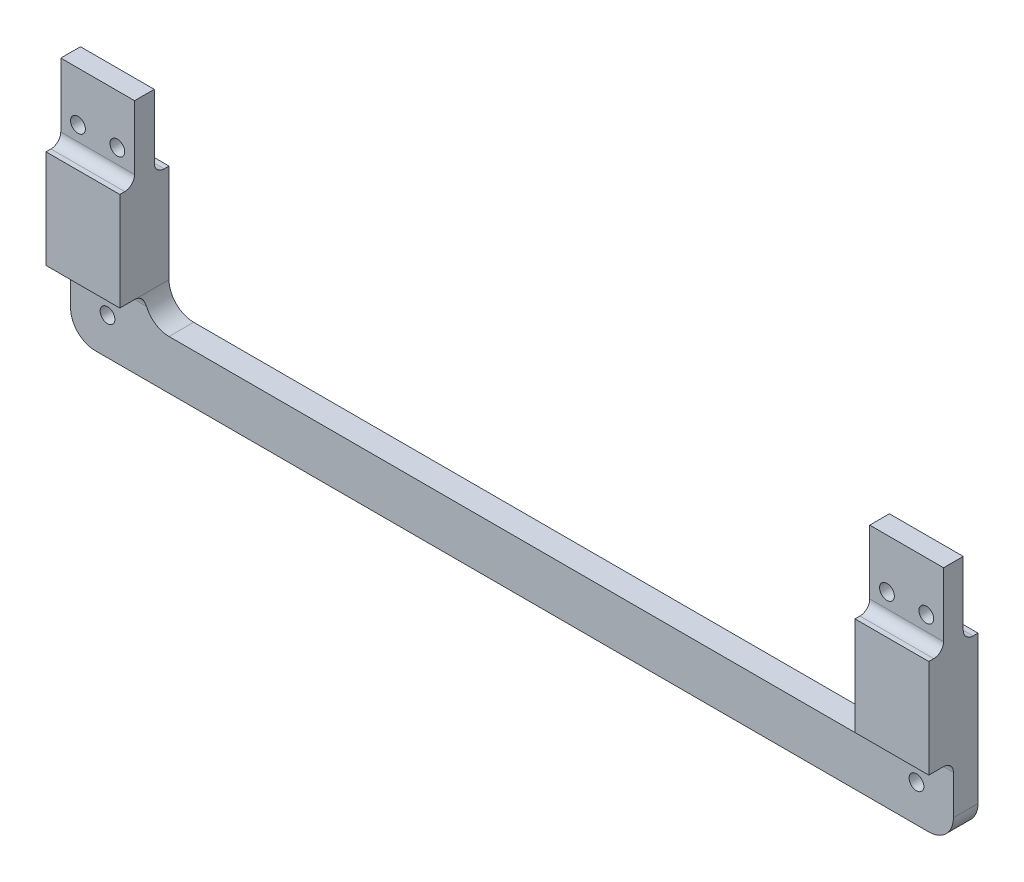
from build123d import *

# Parameters (mm, degrees)
SKETCH1_W            = 15
SKETCH1_H            = 50
BOSS_EXTRUDE1_DEPTH  = 10
SKETCH2_W            = 3
SKETCH2_H            = 15
CUT_EXTRUDE1_DEPTH   = 20
SKETCH3_R            = 1.5
CUT_EXTRUDE2_DEPTH   = 20
SKETCH4_W            = 5
SKETCH4_H            = 15
CUT_EXTRUDE3_DEPTH   = 20
CUT_EXTRUDE4_REACH   = 32.943
SKETCH5_R            = 1.5
FILLET1_R            = 2
SKETCH6_W            = 5
SKETCH6_H            = 10
BOSS_EXTRUDE2_DEPTH  = 149.4
FILLET1_OF_MIRROR5_R = 2
FILLET2_R            = 5


with BuildPart() as part:
    # Sketch1 → Boss-Extrude1 (new body)
    with BuildSketch(Plane.XY):
        with Locations((-8.26142132, 1.154822335)):
            Rectangle(SKETCH1_W, SKETCH1_H)
    boss_extrude1 = extrude(amount=BOSS_EXTRUDE1_DEPTH)

    # Sketch2 → Cut-Extrude1 (cut)
    with BuildSketch(Plane(origin=(-0.76142132, 0, 0), x_dir=(0, 0, -1), z_dir=(1, 0, 0))):
        with Locations((-1.5, 18.654822335)):
            Rectangle(SKETCH2_W, SKETCH2_H)
        with Locations((-8.5, 18.654822335)):
            Rectangle(SKETCH2_W, SKETCH2_H)
    cut_extrude1 = extrude(amount=-CUT_EXTRUDE1_DEPTH, mode=Mode.SUBTRACT)

    # Sketch3 → Cut-Extrude2 (cut)
    with BuildSketch(Plane(origin=(0, 0, 3), x_dir=(-1, 0, 0), z_dir=(0, 0, -1))):
        with Locations(Location((4.26142132, 16.154822335, 0), (0, 0, 90))):
            Circle(SKETCH3_R)
        with Locations(Location((12.26142132, 16.154822335, 0), (0, 0, 90))):
            Circle(SKETCH3_R)
    cut_extrude2 = extrude(amount=-CUT_EXTRUDE2_DEPTH, mode=Mode.SUBTRACT)

    # Sketch4 → Cut-Extrude3 (cut)
    with BuildSketch(Plane(origin=(-0.76142132, 0, 0), x_dir=(0, 0, -1), z_dir=(1, 0, 0))):
        with Locations((-7.5, -16.345177665)):
            Rectangle(SKETCH4_W, SKETCH4_H)
    cut_extrude3 = extrude(amount=-CUT_EXTRUDE3_DEPTH, mode=Mode.SUBTRACT)

    # Sketch5 → Cut-Extrude4 (cut, up to next)
    with BuildSketch(Plane.XY.offset(5), mode=Mode.PRIVATE) as cut_extrude4_sk1:
        with Locations((-8.26142132, -16.345177665)):
            Circle(SKETCH5_R)
    cut_extrude4_tool1 = extrude(cut_extrude4_sk1.sketch, amount=-CUT_EXTRUDE4_REACH, mode=Mode.PRIVATE) & part.part
    cut_extrude4 = cut_extrude4_tool1.solids().sort_by_distance((-8.261421, -16.345178, 5))[0]
    add(cut_extrude4, mode=Mode.SUBTRACT)

    # Fillet1
    fillet1_edges = [part.edges().sort_by_distance(p)[0] for p in [
        (-8.26142132, 11.154822335, 3),
        (-8.26142132, 11.154822335, 7),
        (-8.26142132, -8.845177665, 5),
    ]]
    fillet(fillet1_edges, radius=FILLET1_R)

    # Sketch6 → Boss-Extrude2 (add)
    with BuildSketch(Plane.ZY.offset(15.76142132)):
        with Locations((2.5, -18.845177665)):
            Rectangle(SKETCH6_W, SKETCH6_H)
    extrude(amount=BOSS_EXTRUDE2_DEPTH)

    # Mirror5: Boss-Extrude1, Cut-Extrude1, Cut-Extrude2, Cut-Extrude3, Cut-Extrude4 across plane
    add(boss_extrude1.mirror(Plane.ZY.offset(90.46142132)))
    add(cut_extrude1.mirror(Plane.ZY.offset(90.46142132)), mode=Mode.SUBTRACT)
    add(cut_extrude2.mirror(Plane.ZY.offset(90.46142132)), mode=Mode.SUBTRACT)
    add(cut_extrude3.mirror(Plane.ZY.offset(90.46142132)), mode=Mode.SUBTRACT)
    add(cut_extrude4.mirror(Plane.ZY.offset(90.46142132)), mode=Mode.SUBTRACT)

    # Fillet1 of Mirror5
    fillet1_of_mirror5_edges = [part.edges().sort_by_distance(p)[0] for p in [
        (-172.66142132, 11.154822335, 3),
        (-172.66142132, 11.154822335, 7),
        (-172.66142132, -8.845177665, 5),
    ]]
    fillet(fillet1_of_mirror5_edges, radius=FILLET1_OF_MIRROR5_R)

    # Fillet2
    fillet2_edges = [part.edges().sort_by_distance(p)[0] for p in [
        (-180.16142132, -23.845177665, 2.5),
        (-0.76142132, -23.845177665, 2.5),
        (-165.16142132, -13.845177665, 2.5),
        (-15.76142132, -13.845177665, 2.5),
    ]]
    fillet(fillet2_edges, radius=FILLET2_R - 0.0001)  # a hair under: the kernel refuses the full size


solid = part.part
